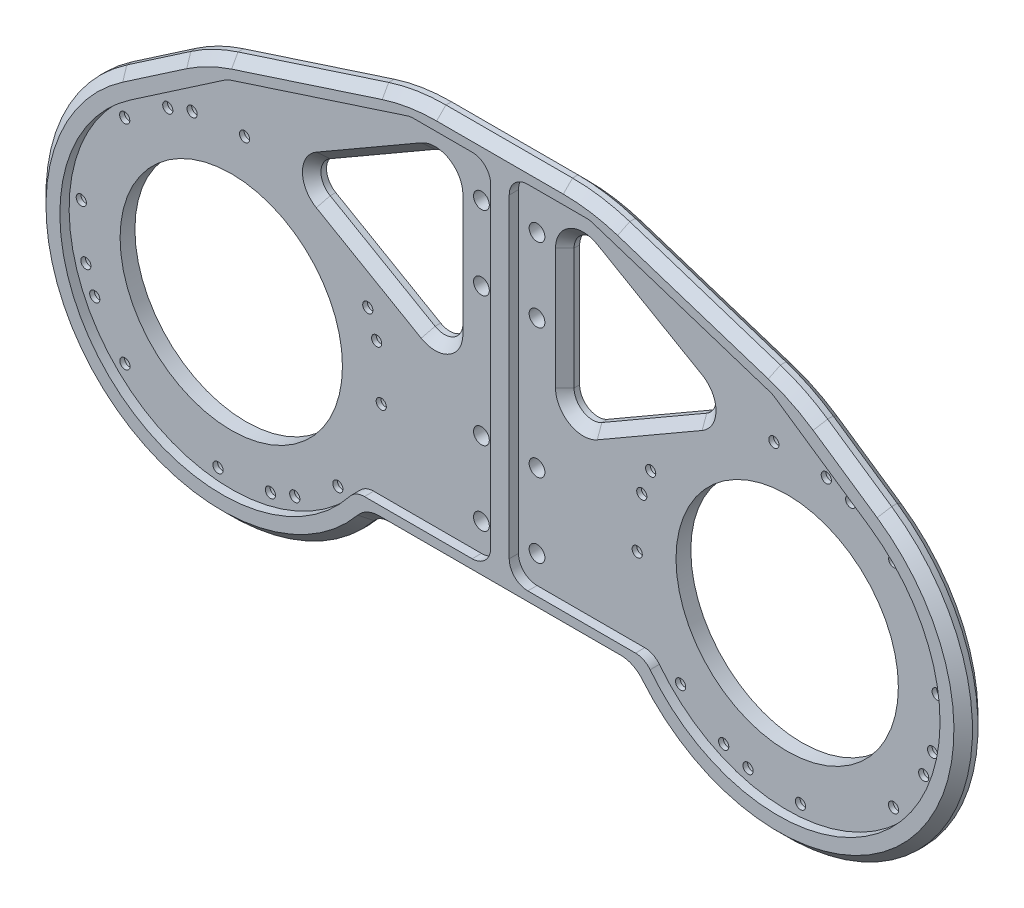
from build123d import *

# Parameters (mm, degrees)
SKETCH_1_R           = 60
EXTRUDE_1_DEPTH      = 8
FILLET_1_R           = 100
CUT_EXTRUDE_4_DEPTH  = 10
CUT_EXTRUDE_5_DEPTH  = 83
FILLET_2_R           = 10
FILLET_3_R           = 100
SKETCH_8_R           = 4.25
CUT_EXTRUDE_6_DEPTH  = 10
EXTRUDE_2_DEPTH      = 5
CUT_EXTRUDE_7_DEPTH  = 94
FILLET_4_R           = 10
CHAMFER_1_SIZE       = 5
SKETCH_15_R          = 2.75
CUT_EXTRUDE_8_DEPTH  = 48.5
SKETCH_16_R          = 6
CUT_EXTRUDE_10_DEPTH = 5.5


with BuildPart() as part:
    # 草图1 → 凸台-拉伸1 (new body)
    with BuildSketch(Plane.XY):
        Polygon((0, 0), (-100, 0), (-869.420884294, 0), (-100, 250), (0, 250), (769.420884294, 0), align=None)
        with Locations((100, 100)):
            Circle(SKETCH_1_R, mode=Mode.SUBTRACT)
        with Locations((-200, 100)):
            Circle(SKETCH_1_R, mode=Mode.SUBTRACT)
    extrude(amount=EXTRUDE_1_DEPTH)

    # 圆角1
    fillet_1_edges = [part.edges().sort_by_distance(p)[0] for p in [
        (-869.420884294, 0, 4),
        (769.420884294, 0, 4),
    ]]
    fillet(fillet_1_edges, radius=FILLET_1_R)

    # 草图6 → 切除-拉伸4 (cut)
    with BuildSketch(Plane.XY.offset(8)):
        with BuildLine():
            Line((-120, 40), (20, 40))
            ThreePointArc((20, 40), (55.27864045, 10.5572809), (100, 0))
            Line((100, 0), (-200, 0))
            ThreePointArc((-200, 0), (-155.27864045, 10.5572809), (-120, 40))
        make_face()
    extrude(amount=-CUT_EXTRUDE_4_DEPTH, mode=Mode.SUBTRACT)

    # 草图7 → 切除-拉伸5 (cut)
    with BuildSketch(Plane.XY.offset(8)):
        with BuildLine():
            Line((-256.388333797, 182.585445519), (-210, 214.258833414))
            Line((-210, 214.258833414), (-268.947432264, 195.10565163))
            ThreePointArc((-268.947432264, 195.10565163), (-336.814566886, 84.356553496), (-238.045732826, 0))
            Line((-238.045732826, 0), (-200, 0))
            ThreePointArc((-200, 0), (-295.54722537, 70.491904093), (-256.388333797, 182.585445519))
        make_face()
        with BuildLine():
            Line((110, 214.258833414), (168.947432264, 195.10565163))
            ThreePointArc((168.947432264, 195.10565163), (236.814566886, 84.356553496), (138.045732826, 0))
            Line((138.045732826, 0), (100, 0))
            ThreePointArc((100, 0), (195.54722537, 70.491904093), (156.388333797, 182.585445519))
            Line((156.388333797, 182.585445519), (110, 214.258833414))
        make_face()
    extrude(amount=-CUT_EXTRUDE_5_DEPTH, mode=Mode.SUBTRACT)

    # 圆角2
    fillet_2_edges = [part.edges().sort_by_distance(p)[0] for p in [
        (20, 40, 4),
        (-120, 40, 4),
    ]]
    fillet(fillet_2_edges, radius=FILLET_2_R)

    # 圆角3
    fillet_3_edges = [part.edges().sort_by_distance(p)[0] for p in [
        (-100, 250, 4),
        (0, 250, 4),
        (-210, 214.258833414, 4),
        (110, 214.258833414, 4),
    ]]
    fillet(fillet_3_edges, radius=FILLET_3_R)

    # 草图8 → 切除-拉伸6 (cut)
    with BuildSketch(Plane.XY.offset(8)):
        with Locations((-35, 65)):
            Circle(SKETCH_8_R)
        with Locations((-35, 105)):
            Circle(SKETCH_8_R)
        with Locations((-35, 175)):
            Circle(SKETCH_8_R)
        with Locations((-35, 215)):
            Circle(SKETCH_8_R)
        with Locations((-65, 215)):
            Circle(SKETCH_8_R)
        with Locations((-65, 175)):
            Circle(SKETCH_8_R)
        with Locations((-65, 105)):
            Circle(SKETCH_8_R)
        with Locations((-65, 65)):
            Circle(SKETCH_8_R)
    extrude(amount=-CUT_EXTRUDE_6_DEPTH, mode=Mode.SUBTRACT)

    # 草图9 → 凸台-拉伸2 (add)
    with BuildSketch(Plane.XY.offset(8)):
        with BuildLine():
            Line((156.388333797, 182.585445519), (121.845416496, 206.170927668))
            ThreePointArc((121.845416496, 206.170927668), (109.548764066, 213.340279426), (96.358782137, 218.691133779))
            Line((96.358782137, 218.691133779), (15.063255405, 245.10565163))
            ThreePointArc((15.063255405, 245.10565163), (-0.194997528, 248.76883406), (-15.838444032, 250))
            Line((-15.838444032, 250), (-84.161555968, 250))
            ThreePointArc((-84.161555968, 250), (-99.805002472, 248.76883406), (-115.063255405, 245.10565163))
            Line((-115.063255405, 245.10565163), (-196.358782137, 218.691133779))
            ThreePointArc((-196.358782137, 218.691133779), (-209.548764066, 213.340279426), (-221.845416496, 206.170927668))
            Line((-221.845416496, 206.170927668), (-256.388333797, 182.585445519))
            ThreePointArc((-256.388333797, 182.585445519), (-273.843422805, 32.567449192), (-122.861078416, 36.363636364))
            ThreePointArc((-122.861078416, 36.363636364), (-119.411200585, 39.045340337), (-115.147186258, 40))
            Line((-115.147186258, 40), (15.147186258, 40))
            ThreePointArc((15.147186258, 40), (19.411200585, 39.045340337), (22.861078416, 36.363636364))
            ThreePointArc((22.861078416, 36.363636364), (173.843422805, 32.567449192), (156.388333797, 182.585445519))
        make_face()
        with BuildLine():
            Line((-45, 50), (28.192966918, 50))
            ThreePointArc((28.192966918, 50), (162.154722909, 38.412335488), (149.339792072, 172.262264829))
            Line((149.339792072, 172.262264829), (97.086815625, 207.939959117))
            Line((97.086815625, 207.939959117), (-1.583844403, 240))
            Line((-1.583844403, 240), (-45, 240))
            Line((-45, 240), (-45, 50))
        make_face(mode=Mode.SUBTRACT)
        with BuildLine():
            Line((-55, 240), (-55, 50))
            Line((-55, 50), (-128.192966918, 50))
            ThreePointArc((-128.192966918, 50), (-262.154722909, 38.412335488), (-249.339792072, 172.262264829))
            Line((-249.339792072, 172.262264829), (-197.086815625, 207.939959117))
            Line((-197.086815625, 207.939959117), (-98.416155597, 240))
            Line((-98.416155597, 240), (-55, 240))
        make_face(mode=Mode.SUBTRACT)
    extrude(amount=EXTRUDE_2_DEPTH)

    # 草图10 → 切除-拉伸7 (cut)
    with BuildSketch(Plane.XY.offset(8)):
        Polygon((-20, 230), (-20, 130), (66.602540378, 180), align=None)
        Polygon((-166.602540378, 180), (-80, 230), (-80, 130), align=None)
    extrude(amount=-CUT_EXTRUDE_7_DEPTH, mode=Mode.SUBTRACT)

    # 圆角4
    fillet_4_edges = [part.edges().sort_by_distance(p)[0] for p in [
        (97.086815625, 207.939959117, 10.5),
        (-1.583844403, 240, 10.5),
        (-45, 240, 10.5),
        (-45, 50, 10.5),
        (28.192966918, 50, 10.5),
        (-128.192966918, 50, 10.5),
        (-55, 50, 10.5),
        (-55, 240, 10.5),
        (-98.416155597, 240, 10.5),
        (-197.086815625, 207.939959117, 10.5),
        (-20, 230, 4),
        (66.602540378, 180, 4),
        (-20, 130, 4),
        (-80, 130, 4),
        (-166.602540378, 180, 4),
        (-80, 230, 4),
    ]]
    fillet(fillet_4_edges, radius=FILLET_4_R)

    # 倒角1
    chamfer_1_edges = [part.edges().sort_by_distance(p)[0] for p in [
        (-50, 40, 0),
        (-273.843422805, 32.567449192, 0),
        (19.411200585, 39.045340337, 0),
        (-119.411200585, 39.045340337, 0),
        (139.116875146, 194.378186594, 0),
        (55.711018771, 231.898392704, 0),
        (-155.711018771, 231.898392704, 0),
        (-50, 250, 0),
        (-209.548764066, 213.340279426, 0),
        (-99.805002472, 248.76883406, 0),
        (-0.194997528, 248.76883406, 0),
        (109.548764066, 213.340279426, 0),
        (173.843422805, 32.567449192, 13),
        (139.116875146, 194.378186594, 13),
        (109.548764066, 213.340279426, 13),
        (55.711018771, 231.898392704, 13),
        (-0.194997528, 248.76883406, 13),
        (-50, 250, 13),
        (-99.805002472, 248.76883406, 13),
        (-155.711018771, 231.898392704, 13),
        (-209.548764066, 213.340279426, 13),
        (-239.116875146, 194.378186594, 13),
        (-273.843422805, 32.567449192, 13),
        (-119.411200585, 39.045340337, 13),
        (-50, 40, 13),
        (19.411200585, 39.045340337, 13),
        (-123.301270189, 155, 8),
        (-123.301270189, 205, 8),
        (-80, 180, 8),
        (23.301270189, 155, 8),
        (-20, 180, 8),
        (23.301270189, 205, 8),
        (-156.602540378, 180, 8),
        (-85, 221.339745962, 8),
        (-85, 138.660254038, 8),
        (-15, 138.660254038, 8),
        (-15, 221.339745962, 8),
        (56.602540378, 180, 8),
        (173.843422805, 32.567449192, 0),
        (-239.116875146, 194.378186594, 0),
    ]]
    chamfer(chamfer_1_edges, length=CHAMFER_1_SIZE - 0.0001)  # a hair under: the kernel refuses the full size

    # 草图15 → 切除-拉伸8 (cut)
    with BuildSketch(Plane.XY.offset(8)):
        with Locations((92.833838772, 180.933359212)):
            Circle(SKETCH_15_R)
        with Locations((121.111221476, 178.459408791)):
            Circle(SKETCH_15_R)
        with Locations((134.260601935, 173.673425705)):
            Circle(SKETCH_15_R)
        with Locations((157.512558498, 157.392230441)):
            Circle(SKETCH_15_R)
        with Locations((157.392230441, 42.487441502)):
            Circle(SKETCH_15_R)
        with Locations((173.673425705, 65.739398065)):
            Circle(SKETCH_15_R)
        with Locations((178.459408791, 78.888778524)):
            Circle(SKETCH_15_R)
        with Locations((180.933359212, 107.166161228)):
            Circle(SKETCH_15_R)
        with Locations((42.487441502, 42.607769559)):
            Circle(SKETCH_15_R)
        with Locations((65.739398065, 26.326574295)):
            Circle(SKETCH_15_R)
        with Locations((78.888778524, 21.540591209)):
            Circle(SKETCH_15_R)
        with Locations((107.166161228, 19.066640788)):
            Circle(SKETCH_15_R)
        with Locations((26.326574295, 134.260601935)):
            Circle(SKETCH_15_R)
        with Locations((21.540591209, 121.111221476)):
            Circle(SKETCH_15_R)
        with Locations((19.066640788, 92.833838772)):
            Circle(SKETCH_15_R)
        with Locations((-119.066640788, 92.833838772)):
            Circle(SKETCH_15_R)
        with Locations((-121.540591209, 121.111221476)):
            Circle(SKETCH_15_R)
        with Locations((-126.326574295, 134.260601935)):
            Circle(SKETCH_15_R)
        with Locations((-207.166161228, 19.066640788)):
            Circle(SKETCH_15_R)
        with Locations((-178.888778524, 21.540591209)):
            Circle(SKETCH_15_R)
        with Locations((-165.739398065, 26.326574295)):
            Circle(SKETCH_15_R)
        with Locations((-142.487441502, 42.607769559)):
            Circle(SKETCH_15_R)
        with Locations((-280.933359212, 107.166161228)):
            Circle(SKETCH_15_R)
        with Locations((-278.459408791, 78.888778524)):
            Circle(SKETCH_15_R)
        with Locations((-273.673425705, 65.739398065)):
            Circle(SKETCH_15_R)
        with Locations((-257.392230441, 42.487441502)):
            Circle(SKETCH_15_R)
        with Locations((-257.512558498, 157.392230441)):
            Circle(SKETCH_15_R)
        with Locations((-234.260601935, 173.673425705)):
            Circle(SKETCH_15_R)
        with Locations((-221.111221476, 178.459408791)):
            Circle(SKETCH_15_R)
        with Locations((-192.833838772, 180.933359212)):
            Circle(SKETCH_15_R)
    extrude(amount=-CUT_EXTRUDE_8_DEPTH, mode=Mode.SUBTRACT)

    # 草图16 → 切除-拉伸10 (cut)
    with BuildSketch(Plane(origin=(0, 0, 0), x_dir=(-1, 0, 0), z_dir=(0, 0, -1))):
        with Locations((192.833838772, 180.933359212)):
            Circle(SKETCH_16_R)
        with Locations((221.111221476, 178.459408791)):
            Circle(SKETCH_16_R)
        with Locations((234.260601935, 173.673425705)):
            Circle(SKETCH_16_R)
        with Locations((257.512558498, 157.392230441)):
            Circle(SKETCH_16_R)
        with Locations((280.933359212, 107.166161228)):
            Circle(SKETCH_16_R)
        with Locations((278.459408791, 78.888778524)):
            Circle(SKETCH_16_R)
        with Locations((273.673425705, 65.739398065)):
            Circle(SKETCH_16_R)
        with Locations((257.392230441, 42.487441502)):
            Circle(SKETCH_16_R)
        with Locations((207.166161228, 19.066640788)):
            Circle(SKETCH_16_R)
        with Locations((178.888778524, 21.540591209)):
            Circle(SKETCH_16_R)
        with Locations((165.739398065, 26.326574295)):
            Circle(SKETCH_16_R)
        with Locations((142.487441502, 42.607769559)):
            Circle(SKETCH_16_R)
        with Locations((119.066640788, 92.833838772)):
            Circle(SKETCH_16_R)
        with Locations((121.540591209, 121.111221476)):
            Circle(SKETCH_16_R)
        with Locations((126.326574295, 134.260601935)):
            Circle(SKETCH_16_R)
        with Locations(Location((-26.326574295, 134.260601935, 0), (0, 0, 180))):
            Circle(SKETCH_16_R)
        with Locations(Location((-21.540591209, 121.111221476, 0), (0, 0, 180))):
            Circle(SKETCH_16_R)
        with Locations(Location((-19.066640788, 92.833838772, 0), (0, 0, 180))):
            Circle(SKETCH_16_R)
        with Locations(Location((-42.487441502, 42.607769559, 0), (0, 0, 180))):
            Circle(SKETCH_16_R)
        with Locations(Location((-65.739398065, 26.326574295, 0), (0, 0, 180))):
            Circle(SKETCH_16_R)
        with Locations(Location((-78.888778524, 21.540591209, 0), (0, 0, 180))):
            Circle(SKETCH_16_R)
        with Locations(Location((-107.166161228, 19.066640788, 0), (0, 0, 180))):
            Circle(SKETCH_16_R)
        with Locations(Location((-157.392230441, 42.487441502, 0), (0, 0, 180))):
            Circle(SKETCH_16_R)
        with Locations(Location((-173.673425705, 65.739398065, 0), (0, 0, 180))):
            Circle(SKETCH_16_R)
        with Locations(Location((-178.459408791, 78.888778524, 0), (0, 0, 180))):
            Circle(SKETCH_16_R)
        with Locations(Location((-180.933359212, 107.166161228, 0), (0, 0, 180))):
            Circle(SKETCH_16_R)
        with Locations(Location((-157.512558498, 157.392230441, 0), (0, 0, 180))):
            Circle(SKETCH_16_R)
        with Locations(Location((-134.260601935, 173.673425705, 0), (0, 0, 180))):
            Circle(SKETCH_16_R)
        with Locations(Location((-121.111221476, 178.459408791, 0), (0, 0, 180))):
            Circle(SKETCH_16_R)
        with Locations(Location((-92.833838772, 180.933359212, 0), (0, 0, 180))):
            Circle(SKETCH_16_R)
    extrude(amount=-CUT_EXTRUDE_10_DEPTH, mode=Mode.SUBTRACT)


solid = part.part
